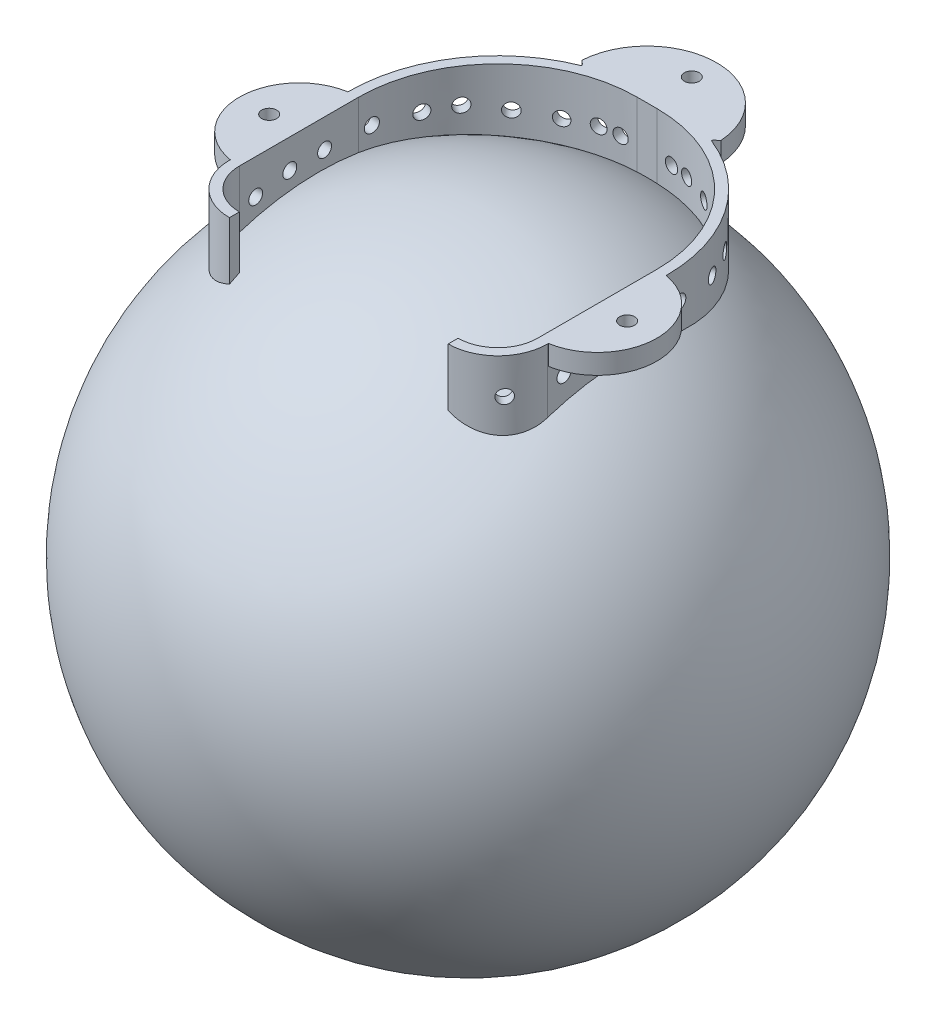
from build123d import *

# Parameters (mm, degrees)
EXTRUDE_THIN2_REACH                   = 39.581
EXTRUDE_THIN2_END_RADIUS              = 15
EXTRUDE_ANCHOR_EARS_DEPTH             = 1
SKETCH16_W                            = 0.375
SKETCH16_H                            = 3.291739257
TAP_DRILL_FOR_M1X0_25_TAP3_AT_2_COUNT = 2
TAP_DRILL_FOR_M1X0_25_TAP3_AT_2_PITCH = 18
TAP_DRILL_FOR_M1X0_25_TAP3_AT_3_COUNT = 2
TAP_DRILL_FOR_M1X0_25_TAP3_AT_3_PITCH = 15.200740114
CUT_EXTRUDE1_DEPTH                    = 0.5
F_0_7_START                           = -8.052623508
F_0_7_0_7_DIAMETER_HOLE1_OUTLINE_R    = 0.35
F_0_7_0_7_DIAMETER_HOLE1_DEPTH        = 0.508755669
F_0_7_START_2                         = -8.107157929
F_0_7_0_7_DIAMETER_HOLE1_2_OUTLINE_R  = 0.35
F_0_7_0_7_DIAMETER_HOLE1_2_DEPTH      = 0.508757306
F_0_7_START_3                         = -8.205448964
F_0_7_0_7_DIAMETER_HOLE1_3_OUTLINE_R  = 0.35
F_0_7_0_7_DIAMETER_HOLE1_3_DEPTH      = 0.50875567
F_0_7_START_4                         = -8.152085126
F_0_7_0_7_DIAMETER_HOLE1_4_OUTLINE_R  = 0.35
F_0_7_0_7_DIAMETER_HOLE1_4_DEPTH      = 0.50875567
F_0_7_START_5                         = -8
F_0_7_0_7_DIAMETER_HOLE1_5_OUTLINE_R  = 0.35
F_0_7_0_7_DIAMETER_HOLE1_5_DEPTH      = 0.5
F_0_7_START_6                         = -8.168887142
F_0_7_0_7_DIAMETER_HOLE1_6_OUTLINE_R  = 0.35
F_0_7_0_7_DIAMETER_HOLE1_6_DEPTH      = 0.50875567
F_0_7_START_7                         = -8.194791383
F_0_7_0_7_DIAMETER_HOLE1_7_OUTLINE_R  = 0.35
F_0_7_0_7_DIAMETER_HOLE1_7_DEPTH      = 0.508755669
F_0_7_START_8                         = -8.042856653
F_0_7_0_7_DIAMETER_HOLE1_8_OUTLINE_R  = 0.35
F_0_7_0_7_DIAMETER_HOLE1_8_DEPTH      = 0.508755669
F_0_7_START_9                         = -10.24159406
F_0_7_0_7_DIAMETER_HOLE1_9_OUTLINE_R  = 0.35
F_0_7_0_7_DIAMETER_HOLE1_9_DEPTH      = 0.530863293


# Read off the part's stored shape, not the designer's step: Ø0.7 (0.7) Diameter Hole1
with BuildPart() as part:
    # Sketch10 → Revolve1 (revolve)
    with BuildSketch(Plane(origin=(0, -15.25, 0), x_dir=(1, 0, 0), z_dir=(0, 1, 0))):
        with BuildLine():
            Line((0, -16.5), (0, 13.5))
            ThreePointArc((0, 13.5), (15, -1.5), (0, -16.5))
        make_face()
    revolve(axis=Axis((0, -15.25, 16.5), (0, 0, -1)))


with BuildPart() as body_2:
    # Extrude-Thin2: up to this sphere (the profile starts outside it)
    extrude_thin2_end = Location((0, -15.25, 1.5)) * Sphere(EXTRUDE_THIN2_END_RADIUS, mode=Mode.PRIVATE)
    # Sketch1 → Extrude-Thin2 (new, up to the surface)
    with BuildSketch(Plane(origin=(0, 0, 0), x_dir=(1, 0, 0), z_dir=(0, 1, 0)), mode=Mode.PRIVATE) as extrude_thin2_sk1:
        with BuildLine():
            Line((-8, -5.5), (-8, 0.5))
            ThreePointArc((-8, 0.5), (-5.803300859, 5.803300859), (-0.5, 8))
            Line((-0.5, 8), (0.5, 8))
            ThreePointArc((0.5, 8), (5.803300859, 5.803300859), (8, 0.5))
            Line((8, 0.5), (8, -5.5))
            ThreePointArc((8, -5.5), (7.267766953, -7.267766953), (5.5, -8))
            Line((5.5, -8), (-5.5, -8))
            ThreePointArc((-5.5, -8), (-7.267766953, -7.267766953), (-8, -5.5))
        make_face()
        with BuildLine():
            Line((-7.5, -5.5), (-7.5, 0.5))
            ThreePointArc((-7.5, 0.5), (-5.449747468, 5.449747468), (-0.5, 7.5))
            Line((-0.5, 7.5), (0.5, 7.5))
            ThreePointArc((0.5, 7.5), (5.449747468, 5.449747468), (7.5, 0.5))
            Line((7.5, 0.5), (7.5, -5.5))
            ThreePointArc((7.5, -5.5), (6.914213562, -6.914213562), (5.5, -7.5))
            Line((5.5, -7.5), (-5.5, -7.5))
            ThreePointArc((-5.5, -7.5), (-6.914213562, -6.914213562), (-7.5, -5.5))
        make_face(mode=Mode.SUBTRACT)
    extrude_thin2_tool1 = extrude(extrude_thin2_sk1.sketch, amount=-EXTRUDE_THIN2_REACH, mode=Mode.PRIVATE) - extrude_thin2_end
    add(extrude_thin2_tool1.solids().sort_by_distance((0, 0, 7.773726))[0])

    # Sketch1<13> → extrude-anchor-ears (add)
    with BuildSketch(Plane(origin=(0, 0, 0), x_dir=(1, 0, 0), z_dir=(0, 1, 0))):
        with BuildLine():
            ThreePointArc((-2.92313458, 7.067223067), (-1.730739317, 7.390956445), (-0.5, 7.5))
            Line((-0.5, 7.5), (0.5, 7.5))
            ThreePointArc((0.5, 7.5), (1.730739317, 7.390956445), (2.92313458, 7.067223067))
            ThreePointArc((2.92313458, 7.067223067), (3.184093504, 7.416168612), (3.492848299, 7.723630852))
            ThreePointArc((3.492848299, 7.723630852), (0, 11), (-3.492848299, 7.723630852))
            ThreePointArc((-3.492848299, 7.723630852), (-3.184093504, 7.416168612), (-2.92313458, 7.067223067))
        make_face()
        with BuildLine():
            Line((-7.5, -5.5), (-7.5, 0.5))
            ThreePointArc((-7.5, 0.5), (-10.5, -2.5), (-7.5, -5.5))
        make_face()
        with BuildLine():
            ThreePointArc((7.5, -5.5), (10.5, -2.5), (7.5, 0.5))
            Line((7.5, 0.5), (7.5, -5.5))
        make_face()
    extrude(amount=-EXTRUDE_ANCHOR_EARS_DEPTH)

    # Sketch16 → Tap Drill for M1x0.25 Tap3 (revolve, cut)
    with BuildSketch(Plane(origin=(9, 0, 2.5), x_dir=(0, 0, 1), z_dir=(1, 0, 0))):
        with Locations((0.1875, 1.645869629)):
            Rectangle(SKETCH16_W, SKETCH16_H)
    tap_drill_for_m1x0_25_tap3 = revolve(axis=Axis((9, 6.35, 2.5), (0, -1, 0)), mode=Mode.SUBTRACT)

    # Tap Drill for M1x0.25 Tap3 at 2: Tap Drill for M1x0.25 Tap3 ×2
    with Locations(*[(-i * TAP_DRILL_FOR_M1X0_25_TAP3_AT_2_PITCH, 0, 0) for i in range(1, TAP_DRILL_FOR_M1X0_25_TAP3_AT_2_COUNT)]):
        add(tap_drill_for_m1x0_25_tap3, mode=Mode.SUBTRACT)

    # Tap Drill for M1x0.25 Tap3 at 3: Tap Drill for M1x0.25 Tap3 ×2
    with Locations(*[Vector(-0.5920764339606881, 0, -0.8058818128909443) * (i * TAP_DRILL_FOR_M1X0_25_TAP3_AT_3_PITCH) for i in range(1, TAP_DRILL_FOR_M1X0_25_TAP3_AT_3_COUNT)]):
        add(tap_drill_for_m1x0_25_tap3, mode=Mode.SUBTRACT)

    # Sketch19 → Cut-Extrude1 (cut)
    with BuildSketch(Plane.XY.offset(8)):
        with BuildLine():
            Line((5.5, -2.900910965), (5.5, 0))
            Line((5.5, 0), (-5.5, 0))
            Line((-5.5, 0), (-5.5, -2.900910965))
            ThreePointArc((-5.5, -2.900910965), (0, -1.731494165), (5.5, -2.900910965))
        make_face()
    extrude(amount=-CUT_EXTRUDE1_DEPTH, mode=Mode.SUBTRACT)

    # Ø0.7 (0.7) Diameter Hole1 outline → Ø0.7 (0.7) Diameter Hole1 (cut)
    with BuildSketch(Plane(origin=(0, 0, 0), x_dir=(0.9937666601370941, 0, -0.11148015608154302), z_dir=(0.11148015608154302, 0, 0.9937666601370941)).offset(F_0_7_START)):
        with Locations((-0.441143252, -2.060148298)):
            Circle(F_0_7_0_7_DIAMETER_HOLE1_OUTLINE_R)
    f_0_7_0_7_diameter_hole1 = extrude(amount=F_0_7_0_7_DIAMETER_HOLE1_DEPTH, mode=Mode.SUBTRACT)

    # 0.7 _0.7_ Diameter Hole1 2 outline → 0.7 _0.7_ Diameter Hole1 2 (cut)
    with BuildSketch(Plane(origin=(0, 0, 0), x_dir=(0.9695942668565711, 0, -0.24471811882014005), z_dir=(0.24471811882014005, 0, 0.9695942668565712)).offset(F_0_7_START_2)):
        with Locations((-0.362438074, -2.024413143)):
            Circle(F_0_7_0_7_DIAMETER_HOLE1_2_OUTLINE_R)
    f_0_7_0_7_diameter_hole1_2 = extrude(amount=F_0_7_0_7_DIAMETER_HOLE1_2_DEPTH, mode=Mode.SUBTRACT)

    # 0.7 _0.7_ Diameter Hole1 3 outline → 0.7 _0.7_ Diameter Hole1 3 (cut)
    with BuildSketch(Plane(origin=(0, 0, 0), x_dir=(0.7538420494439949, 0, -0.6570556783789921), z_dir=(0.657055678378992, 0, 0.753842049443995)).offset(F_0_7_START_3)):
        with Locations((-0.048393186, -2.00231467)):
            Circle(F_0_7_0_7_DIAMETER_HOLE1_3_OUTLINE_R)
    f_0_7_0_7_diameter_hole1_3 = extrude(amount=F_0_7_0_7_DIAMETER_HOLE1_3_DEPTH, mode=Mode.SUBTRACT)

    # 0.7 _0.7_ Diameter Hole1 4 outline → 0.7 _0.7_ Diameter Hole1 4 (cut)
    with BuildSketch(Plane(origin=(0, 0, 0), x_dir=(0, 1, 0), z_dir=(0.9255537063280848, 0, 0.3786163450015669)).offset(F_0_7_START_4)):
        with Locations((-1.716969327, -0.273468681)):
            Circle(F_0_7_0_7_DIAMETER_HOLE1_4_OUTLINE_R)
    f_0_7_0_7_diameter_hole1_4 = extrude(amount=F_0_7_0_7_DIAMETER_HOLE1_4_DEPTH, mode=Mode.SUBTRACT)

    # 0.7 _0.7_ Diameter Hole1 5 outline → 0.7 _0.7_ Diameter Hole1 5 (cut)
    with BuildSketch(Plane.YZ.offset(F_0_7_START_5)):
        with Locations((-1.755351193, 4.679921836)):
            Circle(F_0_7_0_7_DIAMETER_HOLE1_5_OUTLINE_R)
        with Locations((-1.435832157, 1.215665398)):
            Circle(F_0_7_0_7_DIAMETER_HOLE1_5_OUTLINE_R)
        with Locations((-1.463714729, 2.964592546)):
            Circle(F_0_7_0_7_DIAMETER_HOLE1_5_OUTLINE_R)
    f_0_7_0_7_diameter_hole1_5 = extrude(amount=F_0_7_0_7_DIAMETER_HOLE1_5_DEPTH, mode=Mode.SUBTRACT)

    # 0.7 _0.7_ Diameter Hole1 6 outline → 0.7 _0.7_ Diameter Hole1 6 (cut)
    with BuildSketch(Plane(origin=(0, 0, 0), x_dir=(0.8982124122509182, 0, -0.4395616708476601), z_dir=(0.4395616708476601, 0, 0.8982124122509182)).offset(F_0_7_START_6)):
        with Locations((-0.229325371, -2.117265978)):
            Circle(F_0_7_0_7_DIAMETER_HOLE1_6_OUTLINE_R)
    f_0_7_0_7_diameter_hole1_6 = extrude(amount=F_0_7_0_7_DIAMETER_HOLE1_6_DEPTH, mode=Mode.SUBTRACT)

    # 0.7 _0.7_ Diameter Hole1 7 outline → 0.7 _0.7_ Diameter Hole1 7 (cut)
    with BuildSketch(Plane(origin=(0, 0, 0), x_dir=(0.563394658762015, 0, -0.8261879074874144), z_dir=(0.8261879074874144, 0, 0.5633946587620153)).offset(F_0_7_START_7)):
        with Locations((0.131396624, -1.716167875)):
            Circle(F_0_7_0_7_DIAMETER_HOLE1_7_OUTLINE_R)
    f_0_7_0_7_diameter_hole1_7 = extrude(amount=F_0_7_0_7_DIAMETER_HOLE1_7_DEPTH, mode=Mode.SUBTRACT)

    # 0.7 _0.7_ Diameter Hole1 8 outline → 0.7 _0.7_ Diameter Hole1 8 (cut)
    with BuildSketch(Plane(origin=(0, 0, 0), x_dir=(0, 1, 0), z_dir=(0.995964446140709, 0, 0.0897486602887809)).offset(F_0_7_START_8)):
        with Locations((-1.526462117, -0.453107893)):
            Circle(F_0_7_0_7_DIAMETER_HOLE1_8_OUTLINE_R)
    f_0_7_0_7_diameter_hole1_8 = extrude(amount=F_0_7_0_7_DIAMETER_HOLE1_8_DEPTH, mode=Mode.SUBTRACT)

    # 0.7 _0.7_ Diameter Hole1 9 outline → 0.7 _0.7_ Diameter Hole1 9 (cut)
    with BuildSketch(Plane(origin=(0, 0, 0), x_dir=(0.6352836398747318, 0, 0.772278898395853), z_dir=(0.7722788983958528, 0, -0.635283639874732)).offset(F_0_7_START_9)):
        with Locations((0.753473922, 1.786723576)):
            Circle(F_0_7_0_7_DIAMETER_HOLE1_9_OUTLINE_R)
    f_0_7_0_7_diameter_hole1_9 = extrude(amount=F_0_7_0_7_DIAMETER_HOLE1_9_DEPTH, mode=Mode.SUBTRACT)

    # Mirror3: Ø0.7 (0.7) Diameter Hole1, 0.7 _0.7_ Diameter Hole1 2, 0.7 _0.7_ Diameter Hole1 3, 0.7 _0.7_ Diameter Hole1 4, 0.7 _0.7_ Diameter Hole1 5, 0.7 _0.7_ Diameter Hole1 6, 0.7 _0.7_ Diameter Hole1 7, 0.7 _0.7_ Diameter Hole1 8, 0.7 _0.7_ Diameter Hole1 9 across plane
    add(f_0_7_0_7_diameter_hole1.mirror(Plane(origin=(0, 0, 0), x_dir=(0, 0, 1), z_dir=(1, 0, 0))), mode=Mode.SUBTRACT)
    add(f_0_7_0_7_diameter_hole1_2.mirror(Plane(origin=(0, 0, 0), x_dir=(0, 0, 1), z_dir=(1, 0, 0))), mode=Mode.SUBTRACT)
    add(f_0_7_0_7_diameter_hole1_3.mirror(Plane(origin=(0, 0, 0), x_dir=(0, 0, 1), z_dir=(1, 0, 0))), mode=Mode.SUBTRACT)
    add(f_0_7_0_7_diameter_hole1_4.mirror(Plane(origin=(0, 0, 0), x_dir=(0, 0, 1), z_dir=(1, 0, 0))), mode=Mode.SUBTRACT)
    add(f_0_7_0_7_diameter_hole1_5.mirror(Plane(origin=(0, 0, 0), x_dir=(0, 0, 1), z_dir=(1, 0, 0))), mode=Mode.SUBTRACT)
    add(f_0_7_0_7_diameter_hole1_6.mirror(Plane(origin=(0, 0, 0), x_dir=(0, 0, 1), z_dir=(1, 0, 0))), mode=Mode.SUBTRACT)
    add(f_0_7_0_7_diameter_hole1_7.mirror(Plane(origin=(0, 0, 0), x_dir=(0, 0, 1), z_dir=(1, 0, 0))), mode=Mode.SUBTRACT)
    add(f_0_7_0_7_diameter_hole1_8.mirror(Plane(origin=(0, 0, 0), x_dir=(0, 0, 1), z_dir=(1, 0, 0))), mode=Mode.SUBTRACT)
    add(f_0_7_0_7_diameter_hole1_9.mirror(Plane(origin=(0, 0, 0), x_dir=(0, 0, 1), z_dir=(1, 0, 0))), mode=Mode.SUBTRACT)


solid = Compound([part.part, body_2.part])
